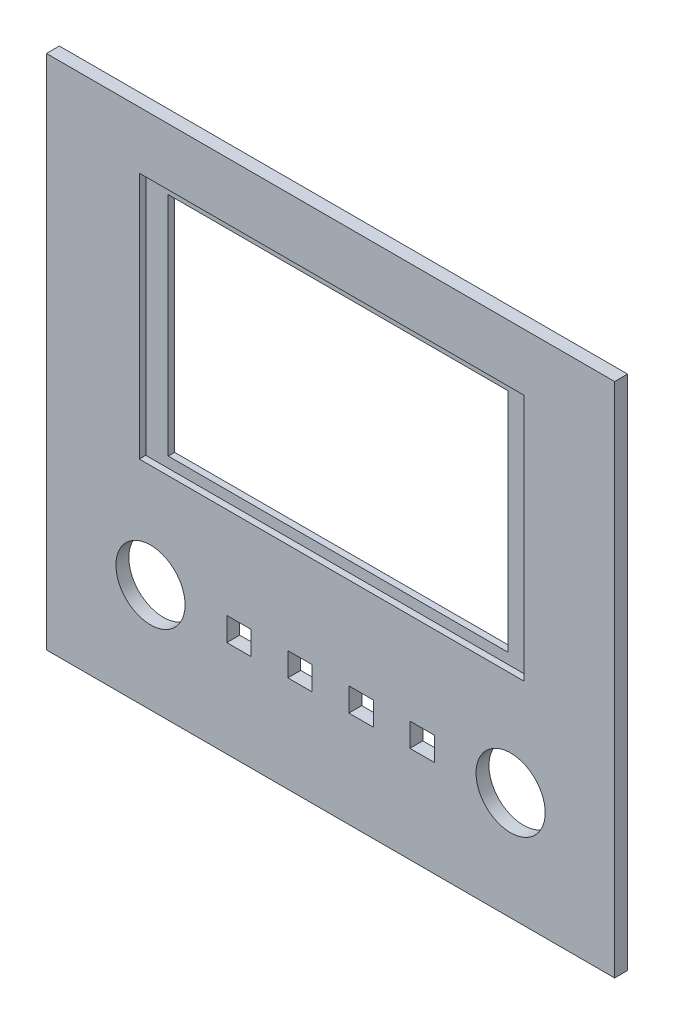
from build123d import *

# Parameters (mm, degrees)
SKETCH1_W           = 139.7
SKETCH1_H           = 127
SKETCH1_W_2         = 83.52
SKETCH1_H_2         = 55.68
SKETCH1_R           = 8.5
SKETCH1_W_3         = 6
SKETCH1_H_3         = 5.8
BOSS_EXTRUDE1_DEPTH = 3.175
SKETCH2_W           = 94.57
SKETCH2_H           = 60.88
SKETCH2_W_2         = 83.52
SKETCH2_H_2         = 55.68
CUT_EXTRUDE1_DEPTH  = 1.5875


with BuildPart() as part:
    # Sketch1 → Boss-Extrude1 (new body)
    with BuildSketch(Plane.XY):
        with Locations((-0.265452364, -19.000597583)):
            Rectangle(SKETCH1_W, SKETCH1_H)
        Rectangle(SKETCH1_W_2, SKETCH1_H_2, mode=Mode.SUBTRACT)
        with Locations((-44.535112364, -55.869967583)):
            Circle(SKETCH1_R, mode=Mode.SUBTRACT)
        with Locations((-22.765452364, -55.869967583)):
            Rectangle(SKETCH1_W_3, SKETCH1_H_3, mode=Mode.SUBTRACT)
        with Locations((-7.765452364, -55.869967583)):
            Rectangle(SKETCH1_W_3, SKETCH1_H_3, mode=Mode.SUBTRACT)
        with Locations((7.234547636, -55.869967583)):
            Rectangle(SKETCH1_W_3, SKETCH1_H_3, mode=Mode.SUBTRACT)
        with Locations((22.234547636, -55.869967583)):
            Rectangle(SKETCH1_W_3, SKETCH1_H_3, mode=Mode.SUBTRACT)
        with Locations((44.004207636, -55.869967583)):
            Circle(SKETCH1_R, mode=Mode.SUBTRACT)
    extrude(amount=BOSS_EXTRUDE1_DEPTH)

    # Sketch2 → Cut-Extrude1 (cut)
    with BuildSketch(Plane.XY.offset(3.175)):
        Rectangle(SKETCH2_W, SKETCH2_H)
        Rectangle(SKETCH2_W_2, SKETCH2_H_2, mode=Mode.SUBTRACT)
    extrude(amount=-CUT_EXTRUDE1_DEPTH, mode=Mode.SUBTRACT)


solid = part.part
